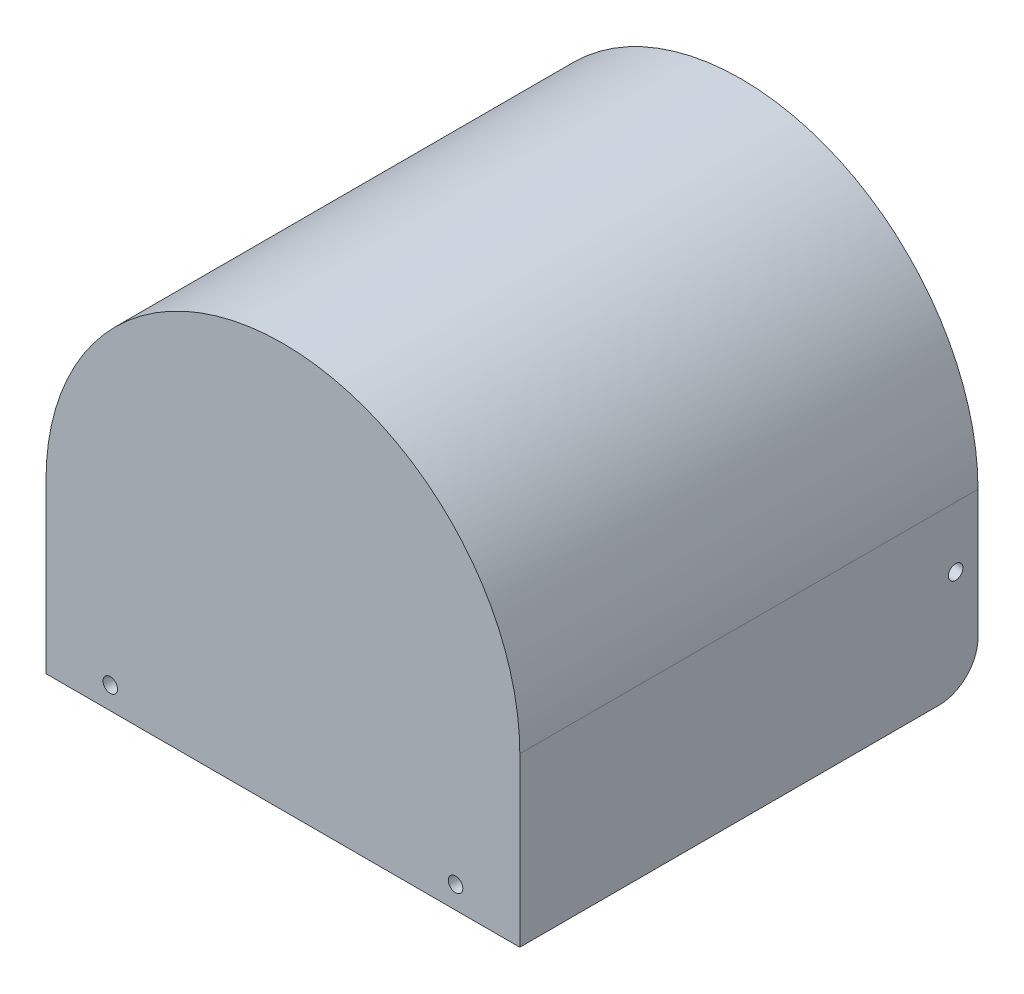
from build123d import *

# Parameters (mm, degrees)
BOSS_EXTRUDE1_DEPTH                  = 82
SKETCH2_W                            = 80.8
SKETCH2_H                            = 2
BOSS_EXTRUDE2_DEPTH                  = 30
BOSS_EXTRUDE2_DIRECTION_2_REACH      = 103.585
BOSS_EXTRUDE2_DIRECTION_2_END_RADIUS = 40.4
SKETCH3_R                            = 1.3
CUT_EXTRUDE1_DEPTH                   = 10
SKETCH4_R                            = 1.3
CUT_EXTRUDE2_DEPTH                   = 126.350708016
FILLET1_R                            = 7


with BuildPart() as part:
    # Sketch1 → Boss-Extrude1 (new body)
    with BuildSketch(Plane.XY):
        with BuildLine():
            Line((-40.4, 0), (-40.4, -30))
            Line((-40.4, -30), (-42.4, -30))
            Line((-42.4, -30), (-42.4, 0))
            ThreePointArc((-42.4, 0), (0, 42.4), (42.4, 0))
            Line((42.4, 0), (42.4, -30))
            Line((42.4, -30), (40.4, -30))
            Line((40.4, -30), (40.4, 0))
            ThreePointArc((40.4, 0), (0, 40.4), (-40.4, 0))
        make_face()
    extrude(amount=BOSS_EXTRUDE1_DEPTH)

    # Sketch2 → Boss-Extrude2 (add)
    with BuildSketch(Plane(origin=(0, 0, 0), x_dir=(1, 0, 0), z_dir=(0, 1, 0))):
        with Locations((0, -81)):
            Rectangle(SKETCH2_W, SKETCH2_H)
    extrude(amount=-BOSS_EXTRUDE2_DEPTH)

    # Boss-Extrude2 direction 2: up to this cylinder (the profile starts inside it)
    boss_extrude2_direction_2_end = Plane(origin=(0, 0, 81), z_dir=(0, 0, -1)) * Cylinder(BOSS_EXTRUDE2_DIRECTION_2_END_RADIUS, 288.97, mode=Mode.PRIVATE)
    # Sketch2 → Boss-Extrude2 direction 2 (add, up to the surface)
    with BuildSketch(Plane(origin=(0, 0, 0), x_dir=(1, 0, 0), z_dir=(0, 1, 0)), mode=Mode.PRIVATE) as boss_extrude2_direction_2_sk1:
        with Locations((0, -81)):
            Rectangle(SKETCH2_W, SKETCH2_H)
    boss_extrude2_direction_2_tool1 = extrude(boss_extrude2_direction_2_sk1.sketch, amount=BOSS_EXTRUDE2_DIRECTION_2_REACH, mode=Mode.PRIVATE) & boss_extrude2_direction_2_end
    add(boss_extrude2_direction_2_tool1.solids().sort_by_distance((0, 0, 81))[0])

    # Sketch3 → Cut-Extrude1 (cut)
    with BuildSketch(Plane.XY.offset(82)):
        with Locations((-30.9, -26)):
            Circle(SKETCH3_R)
        with Locations((30.9, -26)):
            Circle(SKETCH3_R)
    extrude(amount=-CUT_EXTRUDE1_DEPTH, mode=Mode.SUBTRACT)

    # Sketch4 → Cut-Extrude2 (cut, through all)
    with BuildSketch(Plane(origin=(42.4, 0, 0), x_dir=(0, 0, -1), z_dir=(1, 0, 0))):
        with Locations((-4, -10.83)):
            Circle(SKETCH4_R)
    extrude(amount=-CUT_EXTRUDE2_DEPTH, mode=Mode.SUBTRACT)

    # Fillet1
    fillet1_edges = [part.edges().sort_by_distance(p)[0] for p in [
        (-41.4, -30, 0),
        (41.4, -30, 0),
    ]]
    fillet(fillet1_edges, radius=FILLET1_R)


solid = part.part
